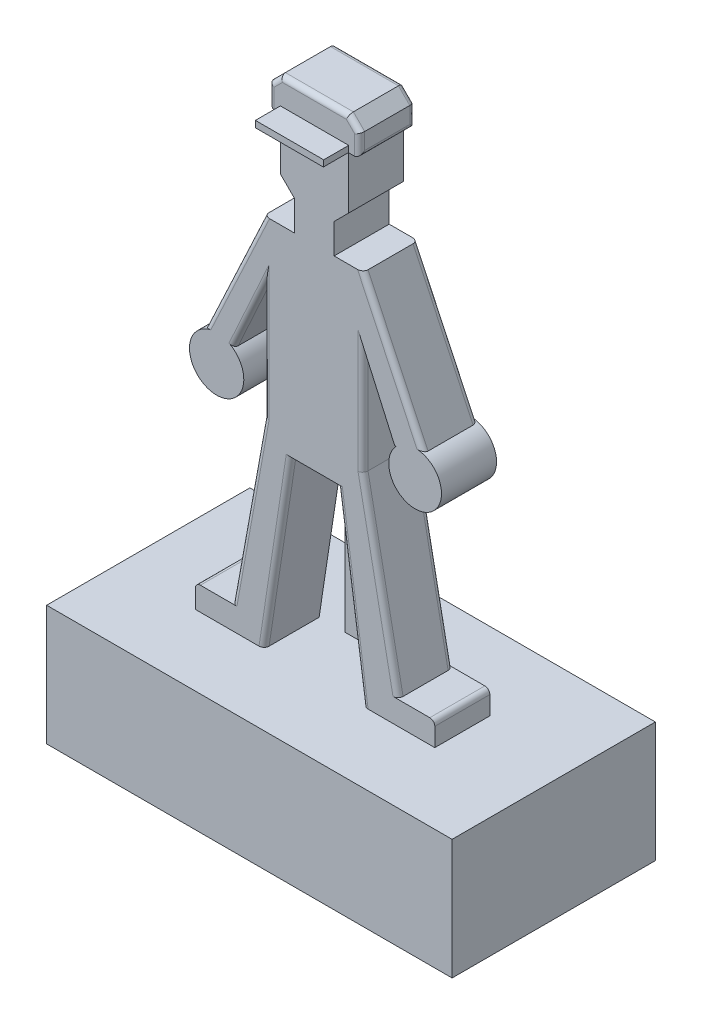
from build123d import *

# Parameters (mm, degrees)
SKETCH1_W           = 5.162383308
SKETCH1_H           = 20.435052184
BOSS_EXTRUDE1_DEPTH = 1.27
SKETCH2_W           = 0.838933851
SKETCH2_H           = 3.882140463
CUT_EXTRUDE1_DEPTH  = 3.81
BOSS_EXTRUDE4_DEPTH = 5.588
BOSS_EXTRUDE5_DEPTH = 2.54
FILLET2_R           = 0.508
FILLET3_R           = 0.508
FILLET4_R           = 0.508
FILLET5_R           = 0.508
FILLET6_R           = 0.508
FILLET7_R           = 0.508
FILLET8_R           = 0.508
FILLET9_R           = 0.508
FILLET10_R          = 0.508
FILLET11_R          = 0.508
FILLET12_R          = 0.508
FILLET13_R          = 0.508
FILLET14_R          = 0.508
SKETCH6_W           = 41.161771016
SKETCH6_H           = 20.635914613
BOSS_EXTRUDE6_DEPTH = 12.192


with BuildPart() as part:
    # Sketch1 → Boss-Extrude1 (new body)
    with BuildSketch(Plane.XY):
        with Locations((-34.98361032, 7.835499756)):
            Rectangle(SKETCH1_W, SKETCH1_H)
    extrude(amount=BOSS_EXTRUDE1_DEPTH)

    # Sketch2 → Cut-Extrude1 (cut)
    with BuildSketch(Plane.ZY.offset(37.564801974)):
        with Locations((0.611191145, 14.932897959)):
            Rectangle(SKETCH2_W, SKETCH2_H)
    extrude(amount=-CUT_EXTRUDE1_DEPTH, mode=Mode.SUBTRACT)

    # Sketch4 → Boss-Extrude4 (add)
    with BuildSketch(Plane.XY.offset(1.27)):
        with BuildLine():
            Line((-43.469086758, 0), (-47.169025003, 0))
            Line((-47.169025003, 0), (-47.169025003, -2.382026336))
            Line((-47.169025003, -2.382026336), (-40.196064464, -2.382026336))
            Line((-40.196064464, -2.382026336), (-37.426646761, 15.860567719))
            Line((-37.426646761, 15.860567719), (-32.766281766, 15.860567719))
            Line((-32.766281766, 15.860567719), (-30.149309074, -2.382026336))
            Line((-30.149309074, -2.382026336), (-22.863276837, -2.382026336))
            Line((-22.863276837, -2.382026336), (-22.863276837, 0))
            Line((-22.863276837, 0), (-26.591676146, 0))
            Line((-26.591676146, 0), (-30.149309074, 18.053025848))
            Line((-30.149309074, 18.053025848), (-30.149309074, 29.327080233))
            Line((-30.149309074, 29.327080233), (-26.938296917, 22.14695002))
            Line((-26.938296917, 22.14695002), (-26.785204153, 22.14695002))
            ThreePointArc((-26.785204153, 22.14695002), (-24.20237045, 17.693920302), (-24.054606769, 22.839663154))
            Line((-24.054606769, 22.839663154), (-30.149309074, 35.737910781))
            Line((-30.149309074, 35.737910781), (-33.080798607, 35.737910781))
            Line((-33.080798607, 35.737910781), (-33.080798607, 38.771936065))
            Line((-33.080798607, 38.771936065), (-31.635826748, 40.216907924))
            Line((-31.635826748, 40.216907924), (-31.635826748, 45.545491871))
            Line((-31.635826748, 45.545491871), (-30.485202747, 45.545491871))
            Line((-30.485202747, 45.545491871), (-30.485202747, 47.725486843))
            Line((-30.485202747, 47.725486843), (-31.635826748, 48.876110845))
            Line((-31.635826748, 48.876110845), (-38.538780409, 48.876110845))
            Line((-38.538780409, 48.876110845), (-39.689404411, 47.725486843))
            Line((-39.689404411, 47.725486843), (-39.689404411, 45.545491871))
            Line((-39.689404411, 45.545491871), (-38.538780409, 45.545491871))
            Line((-38.538780409, 45.545491871), (-38.538780409, 40.216907924))
            Line((-38.538780409, 40.216907924), (-37.09380855, 38.771936065))
            Line((-37.09380855, 38.771936065), (-37.09380855, 35.737910781))
            Line((-37.09380855, 35.737910781), (-40.196064464, 35.737910781))
            Line((-40.196064464, 35.737910781), (-46.273793078, 22.737427679))
            ThreePointArc((-46.273793078, 22.737427679), (-45.25995754, 17.542556601), (-43.322669818, 22.468149387))
            Line((-43.322669818, 22.468149387), (-40.196064464, 29.327080233))
            Line((-40.196064464, 29.327080233), (-40.196064464, 18.053025848))
            Line((-40.196064464, 18.053025848), (-43.469086758, 0))
        make_face()
    extrude(amount=BOSS_EXTRUDE4_DEPTH)

    # Sketch5 → Boss-Extrude5 (add)
    with BuildSketch(Plane.XY.offset(6.858)):
        Polygon((-38.538780409, 45.545491871), (-38.538780409, 46.198921932), (-31.603739784, 46.198921932), (-31.635826748, 45.545491871), align=None)
    extrude(amount=BOSS_EXTRUDE5_DEPTH)

    # Fillet2
    fillet2_edges = [part.edges().sort_by_distance(p)[0] for p in [
        (-28.37049261, 9.026512924, 6.858),
        (-30.149309074, 23.690053041, 6.858),
    ]]
    fillet(fillet2_edges, radius=FILLET2_R)

    # Fillet3
    fillet3_edges = [part.edges().sort_by_distance(p)[0] for p in [
        (-27.101957922, 29.288786967, 1.27),
    ]]
    fillet(fillet3_edges, radius=FILLET3_R)

    # Fillet4
    fillet4_edges = [part.edges().sort_by_distance(p)[0] for p in [
        (-43.234928771, 29.23766923, 1.27),
    ]]
    fillet(fillet4_edges, radius=FILLET4_R)

    # Fillet5
    fillet5_edges = [part.edges().sort_by_distance(p)[0] for p in [
        (-41.832575611, 9.026512924, 1.27),
        (-40.196064464, 23.690053041, 1.27),
    ]]
    fillet(fillet5_edges, radius=FILLET5_R)

    # Fillet6
    fillet6_edges = [part.edges().sort_by_distance(p)[0] for p in [
        (-43.234928771, 29.23766923, 6.858),
    ]]
    fillet(fillet6_edges, radius=FILLET6_R)

    # Fillet7
    fillet7_edges = [part.edges().sort_by_distance(p)[0] for p in [
        (-35.087303579, 48.876110845, 6.858),
        (-39.11409241, 48.300798844, 6.858),
        (-39.689404411, 46.635489357, 6.858),
        (-39.689404411, 45.545491871, 4.064),
        (-39.689404411, 46.635489357, 1.27),
        (-39.11409241, 48.300798844, 1.27),
        (-35.087303579, 48.876110845, 1.27),
        (-31.060514748, 48.300798844, 1.27),
        (-30.485202747, 46.635489357, 1.27),
        (-30.485202747, 45.545491871, 4.064),
        (-30.485202747, 46.635489357, 6.858),
        (-31.060514748, 48.300798844, 6.858),
    ]]
    fillet(fillet7_edges, radius=FILLET7_R)

    # Fillet8
    fillet8_edges = [part.edges().sort_by_distance(p)[0] for p in [
        (-28.37049261, 9.026512924, 1.27),
        (-30.149309074, 23.690053041, 1.27),
    ]]
    fillet(fillet8_edges, radius=FILLET8_R)

    # Fillet9
    fillet9_edges = [part.edges().sort_by_distance(p)[0] for p in [
        (-27.101957922, 29.288786967, 6.858),
    ]]
    fillet(fillet9_edges, radius=FILLET9_R)

    # Fillet10
    fillet10_edges = [part.edges().sort_by_distance(p)[0] for p in [
        (-22.863276837, 0, 4.064),
    ]]
    fillet(fillet10_edges, radius=FILLET10_R)

    # Fillet11
    fillet11_edges = [part.edges().sort_by_distance(p)[0] for p in [
        (-41.759367141, 25.89761481, 6.858),
        (-40.196064464, 23.690053041, 6.858),
        (-41.832575611, 9.026512924, 6.858),
    ]]
    fillet(fillet11_edges, radius=FILLET11_R)

    # Fillet12
    fillet12_edges = [part.edges().sort_by_distance(p)[0] for p in [
        (-38.811355612, 6.739270691, 6.858),
    ]]
    fillet(fillet12_edges, radius=FILLET12_R)

    # Fillet13
    fillet13_edges = [part.edges().sort_by_distance(p)[0] for p in [
        (-31.45779542, 6.739270691, 6.858),
    ]]
    fillet(fillet13_edges, radius=FILLET13_R)

    # Fillet14
    fillet14_edges = [part.edges().sort_by_distance(p)[0] for p in [
        (-47.169025003, 0, 4.064),
    ]]
    fillet(fillet14_edges, radius=FILLET14_R)

    # Sketch6 → Boss-Extrude6 (add)
    with BuildSketch(Plane(origin=(0, -2.382026336, 0), x_dir=(-1, 0, 0), z_dir=(0, -1, 0))):
        with Locations((34.507487472, -3.721284524)):
            Rectangle(SKETCH6_W, SKETCH6_H)
    extrude(amount=BOSS_EXTRUDE6_DEPTH)


solid = part.part
